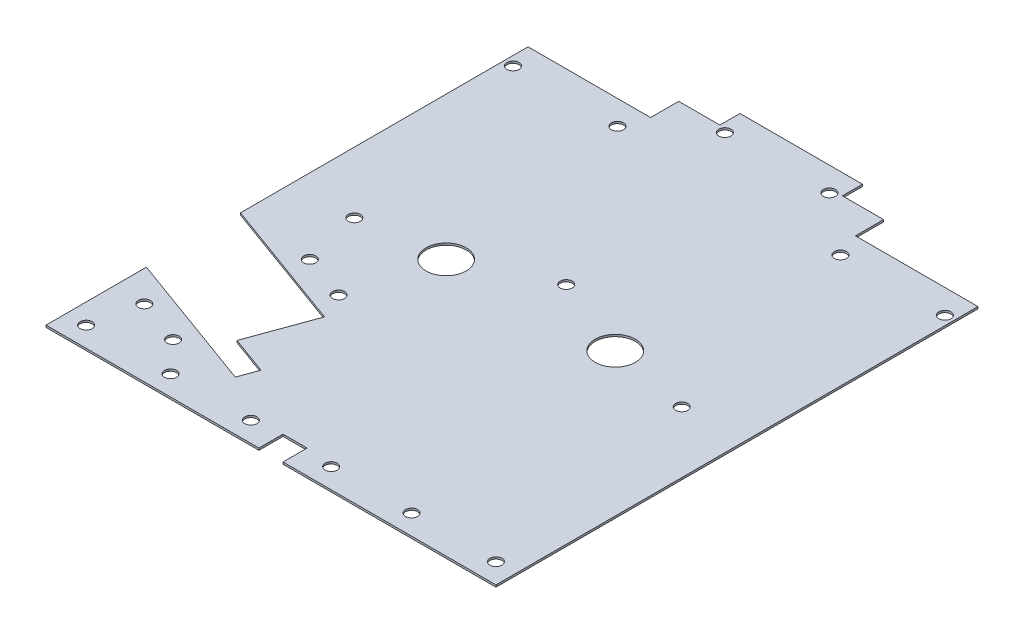
from build123d import *

# Parameters (mm, degrees)
CROQUIS1_W             = 112
CROQUIS1_H             = 132
BRIDA_BASE1_DEPTH      = 0.5
CORTAR_EXTRUIR4_DEPTH  = 10
CROQUIS7_R             = 1.5
CORTAR_EXTRUIR5_DEPTH  = 10
CORTAR_EXTRUIR6_DEPTH  = 10
CROQUIS9_R             = 1.5
CORTAR_EXTRUIR7_DEPTH  = 12
CROQUIS10_R            = 1.5
CORTAR_EXTRUIR8_DEPTH  = 10
CROQUIS11_R            = 1.5
CORTAR_EXTRUIR9_DEPTH  = 10
CROQUIS12_W            = 6
CROQUIS12_H            = 6
CORTAR_EXTRUIR10_DEPTH = 10
CROQUIS13_R            = 5
CORTAR_EXTRUIR11_DEPTH = 10


# Sheet-metal steps are written as plain solids
with BuildPart() as part:
    # Croquis1 → Brida base1 (new body)
    with BuildSketch(Plane(origin=(0, 0, 0), x_dir=(1, 0, 0), z_dir=(0, 1, 0))):
        Rectangle(CROQUIS1_W, CROQUIS1_H)
    extrude(amount=-BRIDA_BASE1_DEPTH)

    # Croquis5 → Cortar-Extruir4 (cut)
    with BuildSketch(Plane(origin=(0, 0, 0), x_dir=(1, 0, 0), z_dir=(0, 1, 0))):
        Polygon((-15.25, 61), (-15.25, 66), (-56, 66), (-56, 54), (-25.5, 54), (-25.5, 61), align=None)
        Polygon((56, 66), (15.25, 66), (15.25, 61), (25.5, 61), (25.5, 54), (56, 54), align=None)
    extrude(amount=-CORTAR_EXTRUIR4_DEPTH, mode=Mode.SUBTRACT)

    # Croquis7 → Cortar-Extruir5 (cut)
    with BuildSketch(Plane(origin=(0, 0, 0), x_dir=(1, 0, 0), z_dir=(0, 1, 0))):
        with Locations(Location((-40.75, -4.5, 0), (0, 0, 270))):
            Circle(CROQUIS7_R)
        with Locations(Location((40.75, -4.5, 0), (0, 0, 90))):
            Circle(CROQUIS7_R)
        with Locations(Location((0, 7.5, 0), (0, 0, 270))):
            Circle(CROQUIS7_R)
    extrude(amount=-CORTAR_EXTRUIR5_DEPTH, mode=Mode.SUBTRACT)

    # Croquis8 → Cortar-Extruir6 (cut)
    with BuildSketch(Plane(origin=(0, 0, 0), x_dir=(1, 0, 0), z_dir=(0, 1, 0))):
        Polygon((-56, -17.588089006), (-56, -41), (-21.238275218, -53.652233112), (-19.528174501, -48.953770009), (-28.925100709, -45.533568575), (-23.110758272, -29.558794022), align=None)
    extrude(amount=-CORTAR_EXTRUIR6_DEPTH, mode=Mode.SUBTRACT)

    # Croquis9 → Cortar-Extruir7 (cut)
    with BuildSketch(Plane(origin=(0, 0, 0), x_dir=(1, 0, 0), z_dir=(0, 1, 0))):
        with Locations(Location((-13, 60, 0), (0, 0, 270))):
            Circle(CROQUIS9_R)
        with Locations(Location((13, 60, 0), (0, 0, 90))):
            Circle(CROQUIS9_R)
        with Locations(Location((-53.75, 48, 0), (0, 0, 270))):
            Circle(CROQUIS9_R)
        with Locations(Location((-27.75, 48, 0), (0, 0, 90))):
            Circle(CROQUIS9_R)
        with Locations(Location((27.75, 48, 0), (0, 0, 270))):
            Circle(CROQUIS9_R)
        with Locations(Location((53.75, 48, 0), (0, 0, 90))):
            Circle(CROQUIS9_R)
    extrude(amount=-CORTAR_EXTRUIR7_DEPTH, mode=Mode.SUBTRACT)

    # Croquis10 → Cortar-Extruir8 (cut)
    with BuildSketch(Plane(origin=(0, 0, 0), x_dir=(1, 0, 0), z_dir=(0, 1, 0))):
        with Locations(Location((-37.346445111, -18.977085256, 0), (0, 0, 270))):
            Circle(CROQUIS10_R)
        with Locations(Location((-26.070133662, -23.081326976, 0), (0, 0, 90))):
            Circle(CROQUIS10_R)
        with Locations(Location((-37.065850057, -53.291809483, 0), (0, 0, 270))):
            Circle(CROQUIS10_R)
        with Locations(Location((-48.342161507, -49.187567763, 0), (0, 0, 90))):
            Circle(CROQUIS10_R)
    extrude(amount=-CORTAR_EXTRUIR8_DEPTH, mode=Mode.SUBTRACT)

    # Croquis11 → Cortar-Extruir9 (cut)
    with BuildSketch(Plane(origin=(0, 0, 0), x_dir=(1, 0, 0), z_dir=(0, 1, 0))):
        with Locations(Location((-10, -61, 0), (0, 0, 270))):
            Circle(CROQUIS11_R)
        with Locations(Location((-30, -61, 0), (0, 0, 270))):
            Circle(CROQUIS11_R)
        with Locations(Location((30, -61, 0), (0, 0, 90))):
            Circle(CROQUIS11_R)
        with Locations(Location((10, -61, 0), (0, 0, 90))):
            Circle(CROQUIS11_R)
        with Locations(Location((-51, -61, 0), (0, 0, 270))):
            Circle(CROQUIS11_R)
        with Locations(Location((51, -61, 0), (0, 0, 90))):
            Circle(CROQUIS11_R)
    extrude(amount=-CORTAR_EXTRUIR9_DEPTH, mode=Mode.SUBTRACT)

    # Croquis12 → Cortar-Extruir10 (cut)
    with BuildSketch(Plane(origin=(0, 0, 0), x_dir=(1, 0, 0), z_dir=(0, 1, 0))):
        with Locations((0, -63)):
            Rectangle(CROQUIS12_W, CROQUIS12_H)
    extrude(amount=-CORTAR_EXTRUIR10_DEPTH, mode=Mode.SUBTRACT)

    # Croquis13 → Cortar-Extruir11 (cut)
    with BuildSketch(Plane(origin=(0, 0, 0), x_dir=(1, 0, 0), z_dir=(0, 1, 0))):
        with Locations(Location((-20.375, -2.011448093, 0), (0, 0, 270))):
            Circle(CROQUIS13_R)
        with Locations(Location((20.375, -0.670482698, 0), (0, 0, 270))):
            Circle(CROQUIS13_R)
    extrude(amount=-CORTAR_EXTRUIR11_DEPTH, mode=Mode.SUBTRACT)


solid = part.part
